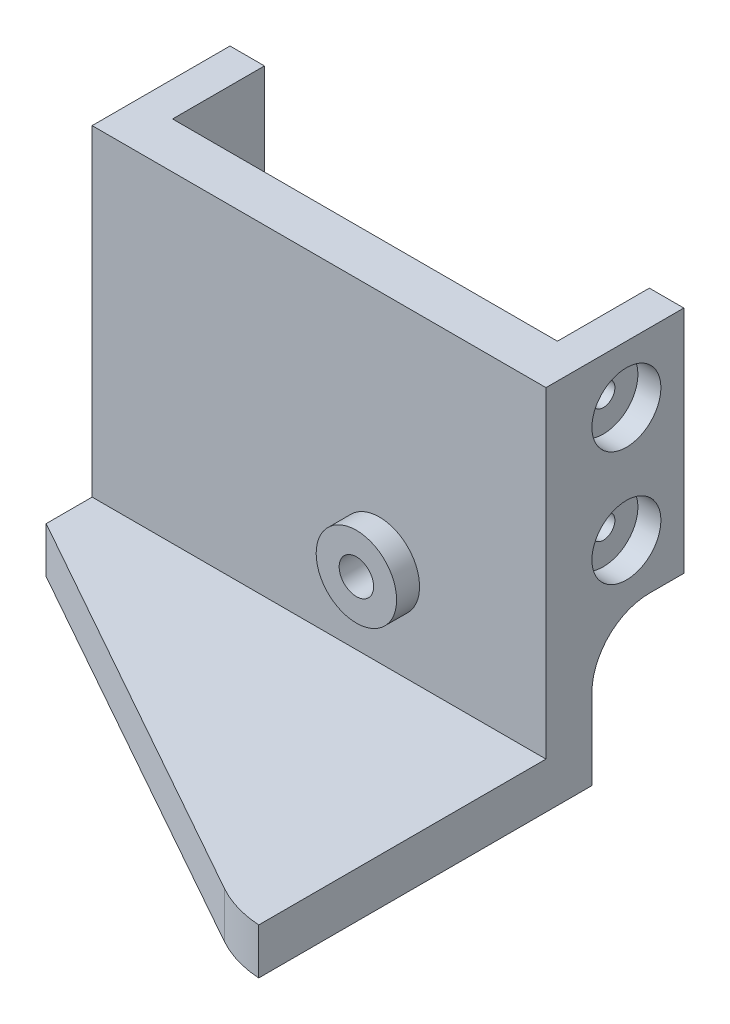
from build123d import *

# Parameters (mm, degrees)
BOSS_EXTRUDE1_DEPTH     = 20
SKETCH2_W               = 37.5
SKETCH2_H               = 4
BOSS_EXTRUDE2_DEPTH     = 12
FILLET1_R               = 5
SKETCH3_W               = 37.5
SKETCH3_H               = 4
BOSS_EXTRUDE3_DEPTH     = 25
SKETCH4_R               = 3.5
SKETCH4_R_2             = 1.5
BOSS_EXTRUDE4_DEPTH     = 2
SKETCH5_R               = 1.5
CUT_EXTRUDE1_DEPTH      = 49.324424466
CUT_EXTRUDE2_DEPTH      = 10
CUT_EXTRUDE3_DEPTH      = 50.307707308
CUT_EXTRUDE3_DEPTH_BACK = 50.307707308
SKETCH8_R               = 1
SKETCH9_R               = 3
BOSS_EXTRUDE5_DEPTH     = 2
FILLET2_R               = 10


with BuildPart() as part:
    # Sketch1 → Boss-Extrude1 (new body)
    with BuildSketch(Plane(origin=(0, 0, 0), x_dir=(1, 0, 0), z_dir=(0, 1, 0))):
        Polygon((0, 12), (0, 0), (37.5, 0), (37.5, 12), (36.5, 12), (36.5, 4), (3, 4), (3, 12), align=None)
    extrude(amount=BOSS_EXTRUDE1_DEPTH)

    # Sketch2 → Boss-Extrude2 (add)
    with BuildSketch(Plane.XZ):
        with Locations((18.75, -2)):
            Rectangle(SKETCH2_W, SKETCH2_H)
    extrude(amount=BOSS_EXTRUDE2_DEPTH)

    # Fillet1
    fillet1_edges = [part.edges().sort_by_distance(p)[0] for p in [
        (37, 0, -4),
        (1.5, 0, -4),
    ]]
    fillet(fillet1_edges, radius=FILLET1_R)

    # Sketch3 → Boss-Extrude3 (add)
    with BuildSketch(Plane.XY):
        with Locations((18.75, -10)):
            Rectangle(SKETCH3_W, SKETCH3_H)
    extrude(amount=BOSS_EXTRUDE3_DEPTH)

    # Sketch4 → Boss-Extrude4 (add)
    with BuildSketch(Plane.XY):
        with Locations(Location((25, -0.5, 0), (0, 0, 180))):
            Circle(SKETCH4_R)
        with Locations((25, -0.5)):
            Circle(SKETCH4_R_2, mode=Mode.SUBTRACT)
    extrude(amount=BOSS_EXTRUDE4_DEPTH)

    # Sketch5 → Cut-Extrude1 (cut, through all)
    with BuildSketch(Plane.XY.offset(2)):
        with Locations(Location((25, -0.5, 0), (0, 0, 180))):
            Circle(SKETCH5_R)
    extrude(amount=-CUT_EXTRUDE1_DEPTH, mode=Mode.SUBTRACT)

    # Sketch6 → Cut-Extrude2 (cut)
    with BuildSketch(Plane(origin=(0, -8, 0), x_dir=(1, 0, 0), z_dir=(0, 1, 0))):
        Polygon((37.5, -25), (0, -4), (0, -25), align=None)
    extrude(amount=-CUT_EXTRUDE2_DEPTH, mode=Mode.SUBTRACT)

    # Sketch8 → Cut-Extrude3 (cut, two sides: drawn at the far end of the back side and taken through both)
    with BuildSketch(Plane(origin=(37.5, 0, 0), x_dir=(0, 0, -1), z_dir=(1, 0, 0)).offset(-CUT_EXTRUDE3_DEPTH_BACK)):
        with Locations((7, 15)):
            Circle(SKETCH8_R)
        with Locations((7, 5)):
            Circle(SKETCH8_R)
    extrude(amount=CUT_EXTRUDE3_DEPTH + CUT_EXTRUDE3_DEPTH_BACK, mode=Mode.SUBTRACT)

    # Sketch9 → Boss-Extrude5 (add)
    with BuildSketch(Plane(origin=(37.5, 0, 0), x_dir=(0, 0, -1), z_dir=(1, 0, 0))):
        with BuildLine():
            Line((12, 20), (0, 20))
            Line((0, 20), (0, -8))
            Line((0, -8), (-25, -8))
            Line((-25, -8), (-25, -12))
            Line((-25, -12), (4, -12))
            Line((4, -12), (4, -5))
            ThreePointArc((4, -5), (5.464466094, -1.464466094), (9, 0))
            Line((9, 0), (12, 0))
            Line((12, 0), (12, 20))
        make_face()
        with Locations(Location((7, 5, 0), (0, 0, 180))):
            Circle(SKETCH9_R, mode=Mode.SUBTRACT)
        with Locations(Location((7, 15, 0), (0, 0, 180))):
            Circle(SKETCH9_R, mode=Mode.SUBTRACT)
    extrude(amount=BOSS_EXTRUDE5_DEPTH)

    # Fillet2
    # the kernel refuses this fillet: 10 mm, written as the material it takes off along each edge
    with BuildSketch(Plane(origin=(37.5, -18.416269062, 25), x_dir=(1, 0, 0), z_dir=(0, 1, 0))) as fillet2_piece_1:
        with BuildLine():
            CenterArc((2.646740347, 9.979064431), FILLET2_R, 240.751173663, 25.540689012)
            Line((-2.239293342, 1.254004272), (-2.337014016, 1.079503069))
            Line((-2.337014016, 1.079503069), (-0.097720674, -0.174501203))
            Line((-0.097720674, -0.174501203), (0, -0.2))
            ThreePointArc((0, -0.2), (1, -0.2), (1.987065193, -0.199581289))
            Line((1.987065193, -0.199581289), (2, 0))
        make_face()
    extrude(amount=16.832538123, mode=Mode.SUBTRACT)


solid = part.part
